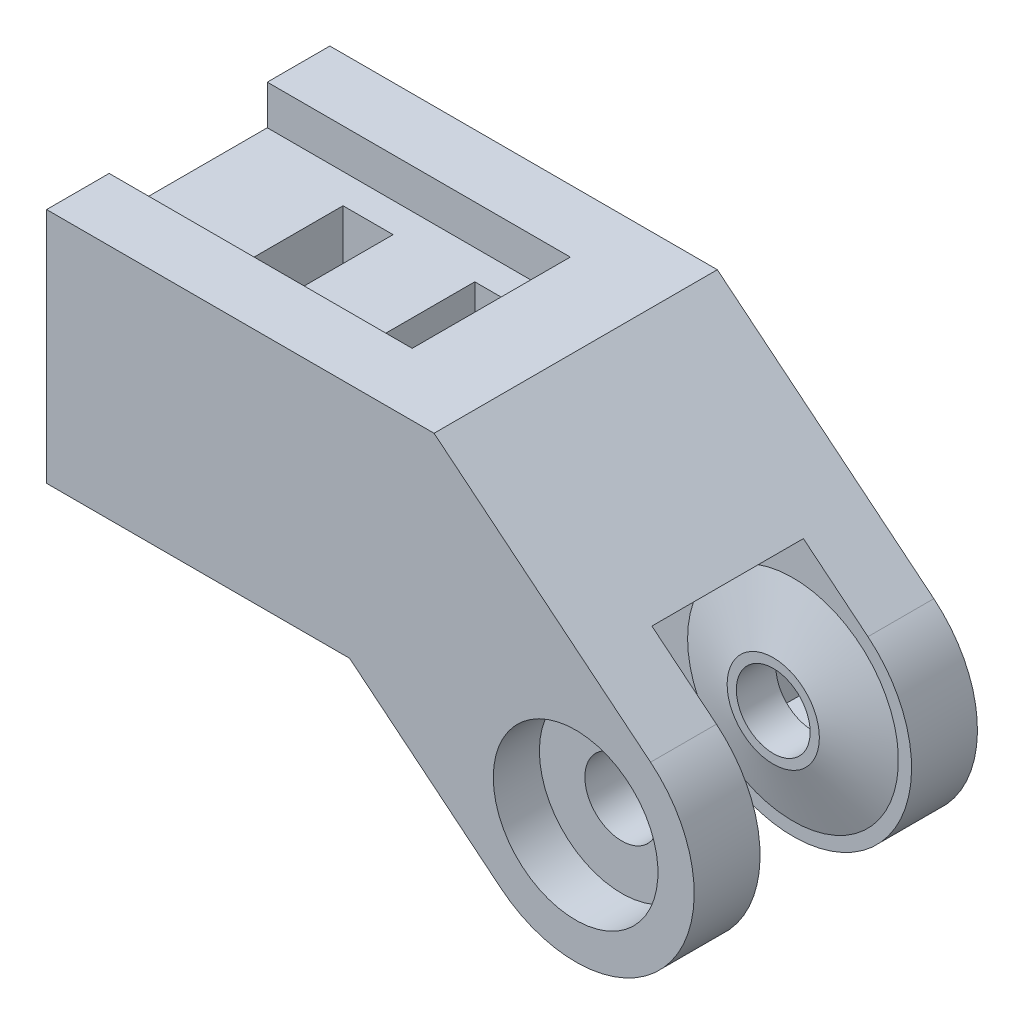
from build123d import *

# Parameters (mm, degrees)
BOSS_EXTRUDE1_DEPTH = 5
SKETCH8_R           = 3.5
BOSS_EXTRUDE5_DEPTH = 1.5
SKETCH10_R          = 8
BOSS_EXTRUDE7_DEPTH = 5.75
SKETCH15_R          = 2.8
CUT_EXTRUDE7_DEPTH  = 10
NUT_CUT_START       = -1.5
SKETCH6_W           = 8.4
SKETCH6_H           = 8.4
NUT_CUT_DEPTH       = 46.182751545
SKETCH16_W          = 12
SKETCH16_H          = 3
CUT_EXTRUDE8_DEPTH  = 23
SKETCH17_R          = 2.35
CUT_EXTRUDE9_DEPTH  = 28
CUT_EXTRUDE10_START = 1.5
SKETCH19_R          = 6.25
CUT_EXTRUDE10_DEPTH = 46.182751545
CUT_EXTRUDE11_START = -8
SKETCH20_R          = 2.35
CUT_EXTRUDE11_DEPTH = 3.8
LPATTERN1_COUNT     = 2
LPATTERN1_PITCH     = 10


with BuildPart() as part:
    # Sketch1 → Boss-Extrude1 (new body)
    with BuildSketch(Plane.XY):
        with BuildLine():
            Line((-40.155138696, -0.836255417), (-17.155138696, -0.836255417))
            Line((-17.155138696, -0.836255417), (-5.68921993, -10.190248634))
            ThreePointArc((-5.68921993, -10.190248634), (6.973720426, -8.905748138), (5.68921993, 3.757192218))
            Line((5.68921993, 3.757192218), (-10.744236538, 17.163744583))
            Line((-10.744236538, 17.163744583), (-40.155138696, 17.163744583))
            Line((-40.155138696, 17.163744583), (-40.155138696, -0.836255417))
        make_face()
    extrude(amount=BOSS_EXTRUDE1_DEPTH)

    # Sketch8 → Boss-Extrude5 (add)
    with BuildSketch(Plane.XY.offset(5)):
        with Locations((0, -3.216528208)):
            Circle(SKETCH8_R)
    extrude(amount=BOSS_EXTRUDE5_DEPTH)

    # Sketch10 → section 0 of loft4
    with BuildSketch(Plane.XY.offset(5), mode=Mode.PRIVATE) as loft4_s0:
        with Locations((0, -3.216528208)):
            Circle(SKETCH10_R)
    # loft up to a face of the part (loft4)
    loft([loft4_s0.sketch, part.faces().sort_by_distance((0, -3.216528208, 6.5))[0]])

    # Sketch14 → Boss-Extrude7 (add)
    with BuildSketch(Plane.XY.offset(5)):
        with BuildLine():
            Line((-40.155138696, -0.836255417), (-40.155138696, 17.163744583))
            Line((-40.155138696, 17.163744583), (-10.744236538, 17.163744583))
            Line((-10.744236538, 17.163744583), (0.78858875, 7.75516846))
            ThreePointArc((0.78858875, 7.75516846), (-8.523436076, 3.736962818), (-10.589851111, -6.192272392))
            Line((-10.589851111, -6.192272392), (-17.155138696, -0.836255417))
            Line((-17.155138696, -0.836255417), (-40.155138696, -0.836255417))
        make_face()
    extrude(amount=BOSS_EXTRUDE7_DEPTH)

    # Sketch15 → Cut-Extrude7 (cut)
    with BuildSketch(Plane(origin=(0, 0, 0), x_dir=(-1, 0, 0), z_dir=(0, 0, -1))):
        with Locations((0, -3.216528208)):
            Circle(SKETCH15_R)
    extrude(amount=-CUT_EXTRUDE7_DEPTH, mode=Mode.SUBTRACT)

    # Mirror1: part across plane


with BuildPart() as part_1:
    add(part.part)
    add(part.part.mirror(Plane(origin=(0, -3.216528208, 10.75), x_dir=(1, 0, 0), z_dir=(0, 0, 1))))

    # Sketch6 → nut-cut (cut, through all)
    with BuildSketch(Plane.XY.offset(5).offset(NUT_CUT_START)):
        with Locations((0, -3.216528208)):
            Rectangle(SKETCH6_W, SKETCH6_H)
    extrude(amount=-NUT_CUT_DEPTH, mode=Mode.SUBTRACT)

    # Sketch16 → Cut-Extrude8 (cut)
    with BuildSketch(Plane.ZY.offset(40.155138696)):
        with Locations((10.75, 0.663744583)):
            Rectangle(SKETCH16_W, SKETCH16_H)
        with Locations((10.75, 15.663744583)):
            Rectangle(SKETCH16_W, SKETCH16_H)
    extrude(amount=-CUT_EXTRUDE8_DEPTH, mode=Mode.SUBTRACT)

    # Sketch17 → Cut-Extrude9 (cut)
    with BuildSketch(Plane.ZY.offset(40.155138696)):
        with Locations((10.75, 8.163744583)):
            Circle(SKETCH17_R)
    extrude(amount=-CUT_EXTRUDE9_DEPTH, mode=Mode.SUBTRACT)

    # Sketch19 → Cut-Extrude10 (cut, through all)
    with BuildSketch(Plane.XY.offset(16.5).offset(CUT_EXTRUDE10_START)):
        with Locations((0, -3.216528208)):
            Circle(SKETCH19_R)
    extrude(amount=CUT_EXTRUDE10_DEPTH, mode=Mode.SUBTRACT)

    # Sketch20 → Cut-Extrude11 (cut)
    with BuildSketch(Plane.ZY.offset(40.155138696).offset(CUT_EXTRUDE11_START)):
        Polygon((14.5, 14.163744583), (7, 14.163744583), (7, 5.998681073), (10.75, 3.833617564), (14.5, 5.998681073), align=None)
        with Locations((10.75, 8.163744583)):
            Circle(SKETCH20_R, mode=Mode.SUBTRACT)
    cut_extrude11 = extrude(amount=-CUT_EXTRUDE11_DEPTH, mode=Mode.SUBTRACT)

    # LPattern1: Cut-Extrude11 ×2
    with Locations(*[(i * LPATTERN1_PITCH, 0, 0) for i in range(1, LPATTERN1_COUNT)]):
        add(cut_extrude11, mode=Mode.SUBTRACT)


solid = part_1.part
